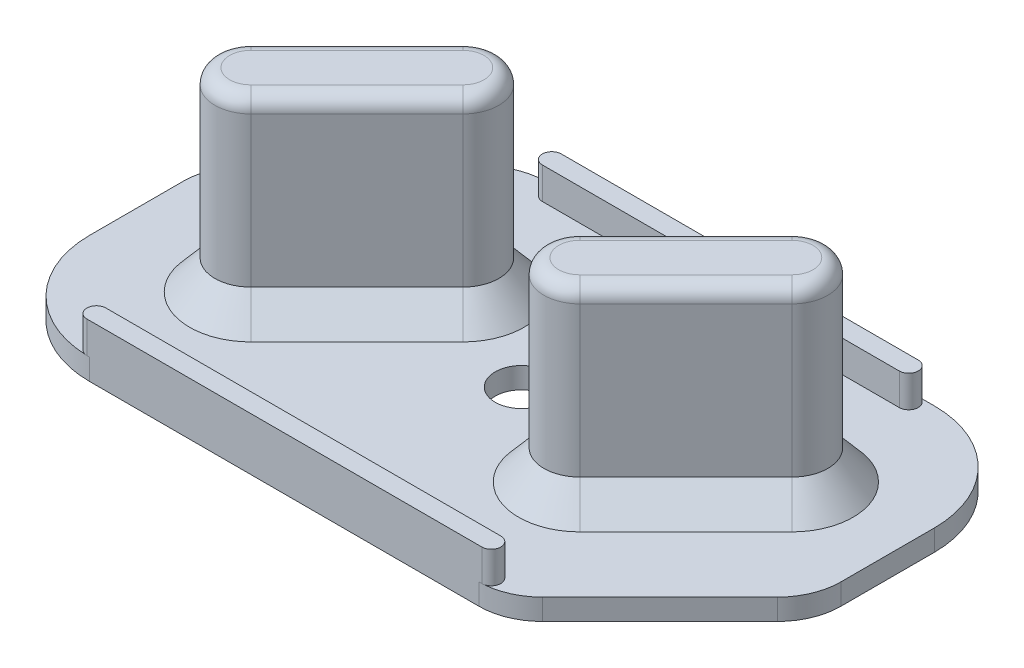
from build123d import *
from OCP.BRepFilletAPI import BRepFilletAPI_MakeChamfer

# Parameters (mm, degrees)
ESQUISSE1_R        = 1.25
BOSS_EXTRU_1_DEPTH = 1
BOSS_EXTRU_2_DEPTH = 9.2
CONG_1_R           = 0.7
BOSS_EXTRU_3_DEPTH = 1.4
CHANFREIN1_SIZE    = 1.4
CHANFREIN1_SIZE_2  = 1.2
BOSS_EXTRU_4_DEPTH = 1.5


with BuildPart() as part:
    # Esquisse1 → Boss.-Extru.1 (new body)
    with BuildSketch(Plane(origin=(0, 0, 0), x_dir=(1, 0, 0), z_dir=(0, 1, 0))):
        with BuildLine():
            Line((-11, -9), (7.435028843, -9))
            ThreePointArc((7.435028843, -9), (8.58307914, -8.771638598), (9.556349186, -8.121320344))
            Line((9.556349186, -8.121320344), (15.121320344, -2.556349186))
            ThreePointArc((15.121320344, -2.556349186), (15.771638598, -1.58307914), (16, -0.435028843))
            Line((16, -0.435028843), (16, 4))
            ThreePointArc((16, 4), (14.535533906, 7.535533906), (11, 9))
            Line((11, 9), (-7.435028843, 9))
            ThreePointArc((-7.435028843, 9), (-8.58307914, 8.771638598), (-9.556349186, 8.121320344))
            Line((-9.556349186, 8.121320344), (-15.121320344, 2.556349186))
            ThreePointArc((-15.121320344, 2.556349186), (-15.771638598, 1.58307914), (-16, 0.435028843))
            Line((-16, 0.435028843), (-16, -4))
            ThreePointArc((-16, -4), (-14.535533906, -7.535533906), (-11, -9))
        make_face()
        with Locations(Location((0.45, 0, 0), (0, 0, 270))):
            Circle(ESQUISSE1_R, mode=Mode.SUBTRACT)
    extrude(amount=BOSS_EXTRU_1_DEPTH)

    # Esquisse2 → Boss.-Extru.2 (add)
    with BuildSketch(Plane(origin=(0, 1, 0), x_dir=(1, 0, 0), z_dir=(0, 1, 0))):
        with BuildLine():
            Line((-11.062539674, -1.308147545), (-6.042081528, 3.712310601))
            ThreePointArc((-6.042081528, 3.712310601), (-3.637918472, 3.712310601), (-3.637918472, 1.308147545))
            Line((-3.637918472, 1.308147545), (-8.658376618, -3.712310601))
            ThreePointArc((-8.658376618, -3.712310601), (-11.062539674, -3.712310601), (-11.062539674, -1.308147545))
        make_face()
        with BuildLine():
            Line((4.517002179, -1.308147545), (9.537460326, 3.712310601))
            ThreePointArc((9.537460326, 3.712310601), (11.941623382, 3.712310601), (11.941623382, 1.308147545))
            Line((11.941623382, 1.308147545), (6.921165235, -3.712310601))
            ThreePointArc((6.921165235, -3.712310601), (4.517002179, -3.712310601), (4.517002179, -1.308147545))
        make_face()
    extrude(amount=BOSS_EXTRU_2_DEPTH)

    # Congé1
    cong_1_edges = [part.edges().sort_by_distance(p)[0] for p in [
        (-11.062539674, 10.2, 3.712310601),
        (-6.148147545, 10.2, 1.202081528),
        (-3.637918472, 10.2, -3.712310601),
        (-8.552310601, 10.2, -1.202081528),
        (4.517002179, 10.2, 3.712310601),
        (9.431394308, 10.2, 1.202081528),
        (11.941623382, 10.2, -3.712310601),
        (7.027231252, 10.2, -1.202081528),
    ]]
    fillet(cong_1_edges, radius=CONG_1_R)

    # Esquisse3 → Boss.-Extru.3 (add)
    with BuildSketch(Plane(origin=(0, 1, 0), x_dir=(1, 0, 0), z_dir=(0, 1, 0))):
        with BuildLine():
            Line((-11.911067812, -0.459619408), (-6.890609665, 4.560838739))
            ThreePointArc((-6.890609665, 4.560838739), (-2.789390335, 4.560838739), (-2.789390335, 0.459619408))
            Line((-2.789390335, 0.459619408), (-7.809848481, -4.560838739))
            ThreePointArc((-7.809848481, -4.560838739), (-11.911067812, -4.560838739), (-11.911067812, -0.459619408))
        make_face()
        with BuildLine():
            Line((3.668474042, -0.459619408), (8.688932188, 4.560838739))
            ThreePointArc((8.688932188, 4.560838739), (12.790151519, 4.560838739), (12.790151519, 0.459619408))
            Line((12.790151519, 0.459619408), (7.769693373, -4.560838739))
            ThreePointArc((7.769693373, -4.560838739), (3.668474042, -4.560838739), (3.668474042, -0.459619408))
        make_face()
    extrude(amount=BOSS_EXTRU_3_DEPTH)

    # Chanfrein1
    chanfrein1_edges_1 = [part.edges().sort_by_distance(p)[0] for p in [
        (12.790151519, 2.4, -4.560838739),
    ]]
    chanfrein1_side_1 = [part.faces().sort_by_distance(p)[0] for p in [
        (12.790151519, 2.376, -4.560838739),
    ]]
    chanfrein1_edges_2 = [part.edges().sort_by_distance(p)[0] for p in [
        (6.178703115, 2.4, -2.050609665),
    ]]
    chanfrein1_side_2 = [part.faces().sort_by_distance(p)[0] for p in [
        (6.178703115, 2.376, -2.050609665),
    ]]
    chanfrein1_edges_3 = [part.edges().sort_by_distance(p)[0] for p in [
        (3.668474042, 2.4, 4.560838739),
    ]]
    chanfrein1_side_3 = [part.faces().sort_by_distance(p)[0] for p in [
        (3.668474042, 2.376, 4.560838739),
    ]]
    chanfrein1_edges_4 = [part.edges().sort_by_distance(p)[0] for p in [
        (10.279922446, 2.4, 2.050609665),
    ]]
    chanfrein1_side_4 = [part.faces().sort_by_distance(p)[0] for p in [
        (10.279922446, 2.376, 2.050609665),
    ]]
    chanfrein1_edges_5 = [part.edges().sort_by_distance(p)[0] for p in [
        (-2.789390335, 2.4, -4.560838739),
    ]]
    chanfrein1_side_5 = [part.faces().sort_by_distance(p)[0] for p in [
        (-2.789390335, 2.376, -4.560838739),
    ]]
    chanfrein1_edges_6 = [part.edges().sort_by_distance(p)[0] for p in [
        (-9.400838739, 2.4, -2.050609665),
    ]]
    chanfrein1_side_6 = [part.faces().sort_by_distance(p)[0] for p in [
        (-9.400838739, 2.376, -2.050609665),
    ]]
    chanfrein1_edges_7 = [part.edges().sort_by_distance(p)[0] for p in [
        (-11.911067812, 2.4, 4.560838739),
    ]]
    chanfrein1_side_7 = [part.faces().sort_by_distance(p)[0] for p in [
        (-11.911067812, 2.376, 4.560838739),
    ]]
    chanfrein1_edges_8 = [part.edges().sort_by_distance(p)[0] for p in [
        (-5.299619408, 2.4, 2.050609665),
    ]]
    chanfrein1_side_8 = [part.faces().sort_by_distance(p)[0] for p in [
        (-5.299619408, 2.376, 2.050609665),
    ]]
    chanfrein1 = BRepFilletAPI_MakeChamfer(part.part.solid().wrapped)
    for e in chanfrein1_edges_1:
        chanfrein1.Add(CHANFREIN1_SIZE - 0.0001, CHANFREIN1_SIZE_2 - 0.0001, e.wrapped, chanfrein1_side_1[0].wrapped)
    for e in chanfrein1_edges_2:
        chanfrein1.Add(CHANFREIN1_SIZE - 0.0001, CHANFREIN1_SIZE_2 - 0.0001, e.wrapped, chanfrein1_side_2[0].wrapped)
    for e in chanfrein1_edges_3:
        chanfrein1.Add(CHANFREIN1_SIZE - 0.0001, CHANFREIN1_SIZE_2 - 0.0001, e.wrapped, chanfrein1_side_3[0].wrapped)
    for e in chanfrein1_edges_4:
        chanfrein1.Add(CHANFREIN1_SIZE - 0.0001, CHANFREIN1_SIZE_2 - 0.0001, e.wrapped, chanfrein1_side_4[0].wrapped)
    for e in chanfrein1_edges_5:
        chanfrein1.Add(CHANFREIN1_SIZE - 0.0001, CHANFREIN1_SIZE_2 - 0.0001, e.wrapped, chanfrein1_side_5[0].wrapped)
    for e in chanfrein1_edges_6:
        chanfrein1.Add(CHANFREIN1_SIZE - 0.0001, CHANFREIN1_SIZE_2 - 0.0001, e.wrapped, chanfrein1_side_6[0].wrapped)
    for e in chanfrein1_edges_7:
        chanfrein1.Add(CHANFREIN1_SIZE - 0.0001, CHANFREIN1_SIZE_2 - 0.0001, e.wrapped, chanfrein1_side_7[0].wrapped)
    for e in chanfrein1_edges_8:
        chanfrein1.Add(CHANFREIN1_SIZE - 0.0001, CHANFREIN1_SIZE_2 - 0.0001, e.wrapped, chanfrein1_side_8[0].wrapped)
    add(Compound.cast(chanfrein1.Shape()), mode=Mode.REPLACE)  # a hair under: the kernel refuses the full size

    # Esquisse4 → Boss.-Extru.4 (add)
    with BuildSketch(Plane(origin=(0, 1, 0), x_dir=(1, 0, 0), z_dir=(0, 1, 0))):
        with BuildLine():
            Line((-6.667514421, 9), (10.232485579, 9))
            ThreePointArc((10.232485579, 9), (10.682485579, 8.55), (10.232485579, 8.1))
            Line((10.232485579, 8.1), (-6.667514421, 8.1))
            ThreePointArc((-6.667514421, 8.1), (-7.117514421, 8.55), (-6.667514421, 9))
        make_face()
        with BuildLine():
            Line((-11.132485579, -8.1), (7.567514421, -8.1))
            ThreePointArc((7.567514421, -8.1), (8.017514421, -8.55), (7.567514421, -9))
            Line((7.567514421, -9), (-11.132485579, -9))
            ThreePointArc((-11.132485579, -9), (-11.582485579, -8.55), (-11.132485579, -8.1))
        make_face()
    extrude(amount=BOSS_EXTRU_4_DEPTH)


solid = part.part
